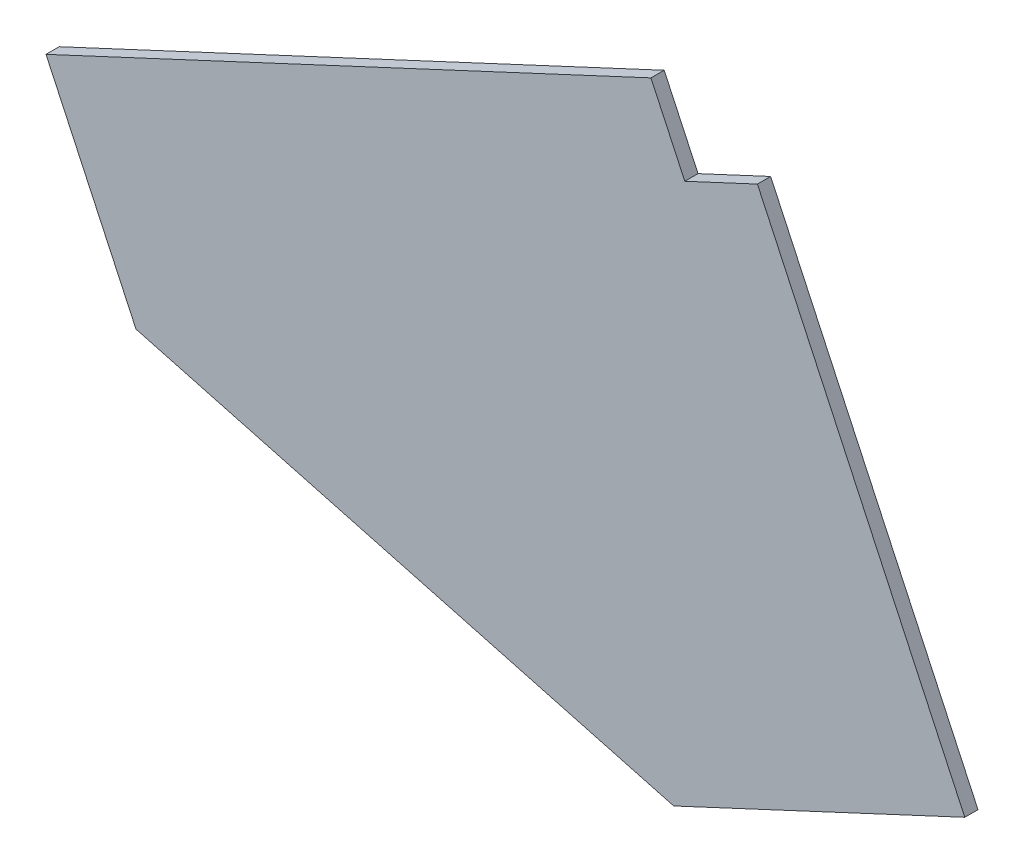
from build123d import *

# Parameters (mm, degrees)
BOSS_EXTRUDE1_DEPTH = 3.3


with BuildPart() as part:
    # Sketch1 → Boss-Extrude1 (new body)
    with BuildSketch(Plane.XY):
        Polygon((130.636566305, -19.593429672), (264.884837628, -55.565145558), (337.548166916, -21.681678643), (285.777429853, 89.341025269), (267.651274112, 80.888660034), (259.198908878, 99.014815774), (108.169003487, 28.58841428), align=None)
    extrude(amount=-BOSS_EXTRUDE1_DEPTH)


solid = part.part
